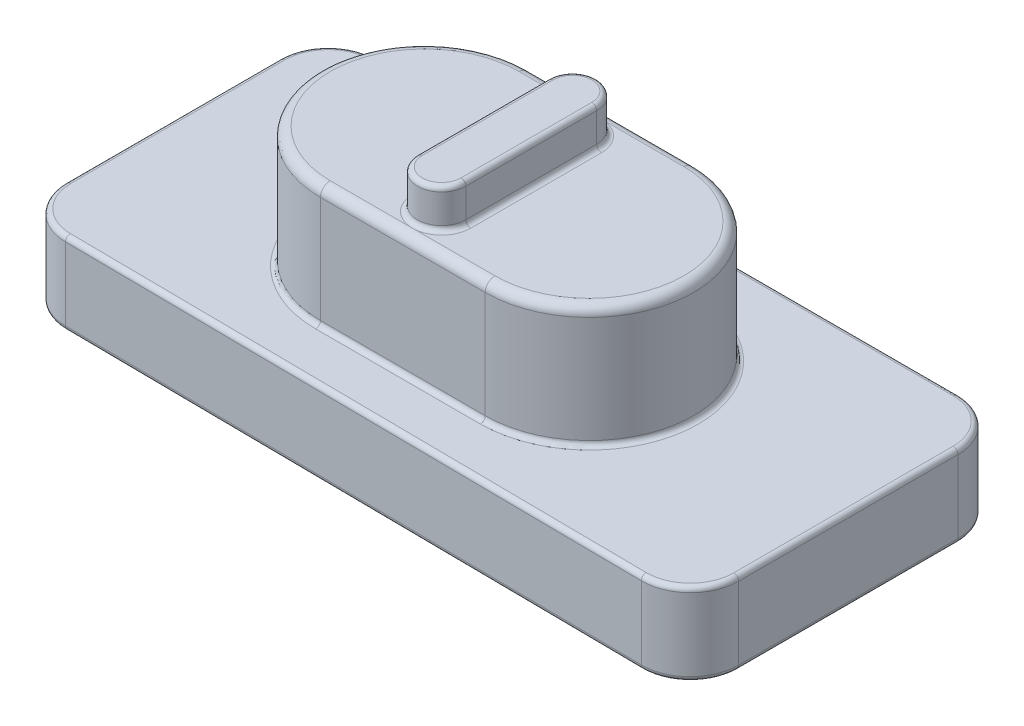
from build123d import *

# Parameters (mm, degrees)
EXTRUDE_1_DEPTH     = 2.5
FILLET_1_R          = 0.2
EXTRUDE_2_DEPTH     = 0.8
FILLET_2_R          = 0.1
EXTRUDE_3_DEPTH     = 1.7
FILLET_3_R          = 0.1
FILLET_4_R          = 1
CUT_EXTRUDE_1_DEPTH = 3.2
FILLET_5_R          = 0.1
FILLET_6_R          = 0.1


with BuildPart() as part:
    # 草图1 → 凸台-拉伸1 (new body)
    with BuildSketch(Plane(origin=(0, 0, 0), x_dir=(1, 0, 0), z_dir=(0, 1, 0))):
        with BuildLine():
            Line((-1.6999999999999993, 2.1499999999999995), (1.6999999999999993, 2.1499999999999995))
            ThreePointArc((1.6999999999999993, 2.1499999999999995), (3.8499999999999996, 3.1e-16), (1.6999999999999993, -2.1499999999999995))
            Line((1.6999999999999993, -2.1499999999999995), (-1.6999999999999993, -2.1499999999999995))
            ThreePointArc((-1.6999999999999993, -2.1499999999999995), (-3.8499999999999996, -9e-17), (-1.6999999999999993, 2.1499999999999995))
        make_face()
    extrude(amount=EXTRUDE_1_DEPTH)

    # 圆角1
    fillet_1_edges = [part.edges().sort_by_distance(p)[0] for p in [
        (3.8499999999999996, 2.5, 5e-17),
        (0, 2.5, -2.1499999999999995),
        (-3.8499999999999996, 2.5, 7e-17),
        (0, 2.5, 2.1499999999999995),
    ]]
    fillet(fillet_1_edges, radius=FILLET_1_R)

    # 草图2 → 凸台-拉伸2 (add)
    with BuildSketch(Plane(origin=(0, 2.5, 0), x_dir=(1, 0, 0), z_dir=(0, 1, 0))):
        with BuildLine():
            Line((0.5, 1.3499999999999992), (0.5, -1.3499999999999992))
            ThreePointArc((0.5, -1.3499999999999992), (-9e-17, -1.8499999999999992), (-0.5, -1.3499999999999992))
            Line((-0.5, -1.3499999999999992), (-0.5, 1.3499999999999992))
            ThreePointArc((-0.5, 1.3499999999999992), (3e-17, 1.8499999999999992), (0.5, 1.3499999999999992))
        make_face()
    extrude(amount=EXTRUDE_2_DEPTH)

    # 圆角2
    fillet_2_edges = [part.edges().sort_by_distance(p)[0] for p in [
        (-2e-17, 3.3, -1.8499999999999992),
        (-0.5, 3.3, 0),
        (0, 3.3, 1.8499999999999992),
        (0.5, 3.3, 0),
    ]]
    fillet(fillet_2_edges, radius=FILLET_2_R)

    # 草图3 → 凸台-拉伸3 (add)
    with BuildSketch(Plane.XZ):
        Polygon((-6.926351251636018, 3.166332000747894), (-6.926351251636018, -3.2336679992521065), (7.073648748363982, -3.2336679992521065), (7.07364874836398, 3.302435981734463), align=None)
    extrude(amount=EXTRUDE_3_DEPTH)

    # 圆角3
    fillet_3_edges = [part.edges().sort_by_distance(p)[0] for p in [
        (0, 0, -2.1499999999999995),
        (7.073648748363981, 0, 0.03438399124117808),
        (0.07364874836398094, 0, 3.2343839912411783),
        (3.8499999999999996, 0, 5e-17),
        (-6.926351251636018, 0, -0.03366799925210628),
        (0.07364874836398183, 0, -3.2336679992521065),
        (7.073648748363981, -1.7, 0.03438399124117808),
        (0.07364874836398094, -1.7, 3.2343839912411783),
        (-6.926351251636018, -1.7, -0.03366799925210628),
        (0.07364874836398183, -1.7, -3.2336679992521065),
        (0, 0, 2.1499999999999995),
        (-3.8499999999999996, 0, 7e-17),
    ]]
    fillet(fillet_3_edges, radius=FILLET_3_R)

    # 圆角4
    # the kernel refuses this fillet: 1 mm, written as the material it takes off along each edge
    with BuildSketch(Plane(origin=(6.073648748363982, 0, -2.2336679992521065), x_dir=(1, 0, 2.7e-16), z_dir=(-2.7e-16, 0, 1))) as fillet_4_piece_1:
        with BuildLine():
            CenterArc((0.9, -0.1), 0.1, 0, 90)
            Line((1, -0.1), (1, 0))
            Line((1, 0), (0.9, 0))
        make_face()
    revolve(axis=Axis((6.073648748363982, 0, -2.2336679992521065), (0, 1, 0)), revolution_arc=90.00000000000001, mode=Mode.SUBTRACT)
    with BuildSketch(Plane(origin=(-5.926351251636018, 0, -2.2336679992521065), x_dir=(0, 0, -1), z_dir=(1, 0, 0))) as fillet_4_piece_2:
        with BuildLine():
            CenterArc((0.9, -0.1), 0.1, 0, 90)
            Line((1, -0.1), (1, 0))
            Line((1, 0), (0.9, 0))
        make_face()
    revolve(axis=Axis((-5.926351251636018, 0, -2.2336679992521065), (0, 1, 0)), revolution_arc=90, mode=Mode.SUBTRACT)
    with BuildSketch(Plane(origin=(6.073648748363981, 0, 2.2926670140722325), x_dir=(-0.00972125355235531, 0, 0.999952747498286), z_dir=(-0.999952747498286, 0, -0.00972125355235531))) as fillet_4_piece_3:
        with BuildLine():
            CenterArc((0.9, -0.1), 0.1, 0, 90)
            Line((1, -0.1), (1, 0))
            Line((1, 0), (0.9, 0))
        make_face()
    revolve(axis=Axis((6.073648748363981, 0, 2.2926670140722325), (0, 1, 0)), revolution_arc=90.5569955732989, mode=Mode.SUBTRACT)
    with BuildSketch(Plane(origin=(-5.926351251636018, 0, 2.1760064589408876), x_dir=(-1, 0, 0), z_dir=(0, 0, -1))) as fillet_4_piece_4:
        with BuildLine():
            CenterArc((0.9, -0.1), 0.1, 0, 90)
            Line((1, -0.1), (1, 0))
            Line((1, 0), (0.9, 0))
        make_face()
    revolve(axis=Axis((-5.926351251636018, 0, 2.1760064589408876), (0, 1, 0)), revolution_arc=89.44300442670108, mode=Mode.SUBTRACT)
    with BuildSketch(Plane(origin=(-5.926351251636018, -1.7, 2.1760064589408876), x_dir=(-0.00972125355235531, 0, 0.999952747498286), z_dir=(0.999952747498286, 0, 0.00972125355235531))) as fillet_4_piece_5:
        with BuildLine():
            CenterArc((0.9, -0.1), 0.1, 0, 90)
            Line((1, -0.1), (1, 0))
            Line((1, 0), (0.9, 0))
        make_face()
    revolve(axis=Axis((-5.926351251636018, -1.7, 2.1760064589408876), (0, -1, 0)), revolution_arc=89.44300442670108, mode=Mode.SUBTRACT)
    with BuildSketch(Plane(origin=(6.073648748363981, -1.7, 2.2926670140722325), x_dir=(1, 0, 2.7e-16), z_dir=(2.7e-16, 0, -1))) as fillet_4_piece_6:
        with BuildLine():
            CenterArc((0.9, -0.1), 0.1, 0, 90)
            Line((1, -0.1), (1, 0))
            Line((1, 0), (0.9, 0))
        make_face()
    revolve(axis=Axis((6.073648748363981, -1.7, 2.2926670140722325), (0, -1, 0)), revolution_arc=90.5569955732989, mode=Mode.SUBTRACT)
    with BuildSketch(Plane(origin=(-5.926351251636018, -1.7, -2.2336679992521065), x_dir=(-1, 0, 0), z_dir=(0, 0, 1))) as fillet_4_piece_7:
        with BuildLine():
            CenterArc((0.9, -0.1), 0.1, 0, 90)
            Line((1, -0.1), (1, 0))
            Line((1, 0), (0.9, 0))
        make_face()
    revolve(axis=Axis((-5.926351251636018, -1.7, -2.2336679992521065), (0, -1, 0)), revolution_arc=90, mode=Mode.SUBTRACT)
    with BuildSketch(Plane(origin=(6.073648748363982, -1.7, -2.2336679992521065), x_dir=(0, 0, -1), z_dir=(-1, 0, 0))) as fillet_4_piece_8:
        with BuildLine():
            CenterArc((0.9, -0.1), 0.1, 0, 90)
            Line((1, -0.1), (1, 0))
            Line((1, 0), (0.9, 0))
        make_face()
    revolve(axis=Axis((6.073648748363982, -1.7, -2.2336679992521065), (0, -1, 0)), revolution_arc=90.00000000000001, mode=Mode.SUBTRACT)
    with BuildSketch(Plane(origin=(-6.926351251636018, 2.17089e-12, 3.166332000747894), x_dir=(0, 0, -1), z_dir=(0, -1, 0))) as fillet_4_piece_9:
        with BuildLine():
            CenterArc((FILLET_4_R * 0.990325541807, FILLET_4_R), FILLET_4_R, 180.556995573299, 89.44300442670101)
            Line((-FILLET_4_R * 0.00962720569128, FILLET_4_R * 0.990278746448), (0, 0))
            Line((0, 0), (FILLET_4_R * 0.990325541807, 0))
        make_face()
    extrude(amount=1.7000000000000002, mode=Mode.SUBTRACT)
    with BuildSketch(Plane(origin=(7.07364874836398, 2.1709e-12, 3.302435981734463), x_dir=(-0.9999527474982859, 0, -0.009721253552355385), z_dir=(0, -1, 0))) as fillet_4_piece_10:
        with BuildLine():
            CenterArc((FILLET_4_R * 1.00976896766, FILLET_4_R), FILLET_4_R, 179.4430044267011, 90.55699557329888)
            Line((FILLET_4_R * 0.00981622016394, FILLET_4_R * 1.00972125355), (0, 0))
            Line((0, 0), (FILLET_4_R * 1.00976896766, 0))
        make_face()
    extrude(amount=1.6999999999999997, mode=Mode.SUBTRACT)
    with BuildSketch(Plane(origin=(-6.926351251636018, 2.1709e-12, -3.2336679992521065), x_dir=(0, 0, 1), z_dir=(0, -1, 0))) as fillet_4_piece_11:
        with BuildLine():
            CenterArc((FILLET_4_R, -FILLET_4_R), FILLET_4_R, 90, 90)
            Line((0, -FILLET_4_R), (0, 0))
            Line((0, 0), (FILLET_4_R, 0))
        make_face()
    extrude(amount=1.6999999999999997, mode=Mode.SUBTRACT)
    with BuildSketch(Plane(origin=(7.073648748363982, 2.1709e-12, -3.2336679992521065), x_dir=(-1, 0, 0), z_dir=(0, -1, 0))) as fillet_4_piece_12:
        with BuildLine():
            CenterArc((FILLET_4_R, -FILLET_4_R), FILLET_4_R, 90, 90)
            Line((0, -FILLET_4_R), (0, 0))
            Line((0, 0), (FILLET_4_R, 0))
        make_face()
    extrude(amount=1.6999999999999997, mode=Mode.SUBTRACT)

    # 草图5 → 切除-拉伸1 (cut)
    with BuildSketch(Plane.XZ.offset(1.7)):
        Polygon((-1.0250000000000004, 1.8), (1.0249999999999997, 1.8000000000000003), (1.0250000000000001, -1.7999999999999998), (-1.0249999999999997, -1.7999999999999998), align=None)
    extrude(amount=-CUT_EXTRUDE_1_DEPTH, mode=Mode.SUBTRACT)

    # 圆角5
    fillet_5_edges = [part.edges().sort_by_distance(p)[0] for p in [
        (1.025, -1.7, 2.2e-16),
        (-4.4e-16, -1.7, 1.8000000000000003),
        (-1.025, -1.7, 0),
        (2.2e-16, -1.7, -1.7999999999999998),
    ]]
    fillet(fillet_5_edges, radius=FILLET_5_R)

    # 圆角6
    fillet_6_edges = [part.edges().sort_by_distance(p)[0] for p in [
        (0.5, 2.5, 0),
        (0, 2.5, 1.8499999999999992),
        (-0.5, 2.5, 0),
        (-2e-17, 2.5, -1.8499999999999992),
    ]]
    fillet(fillet_6_edges, radius=FILLET_6_R)


solid = part.part
